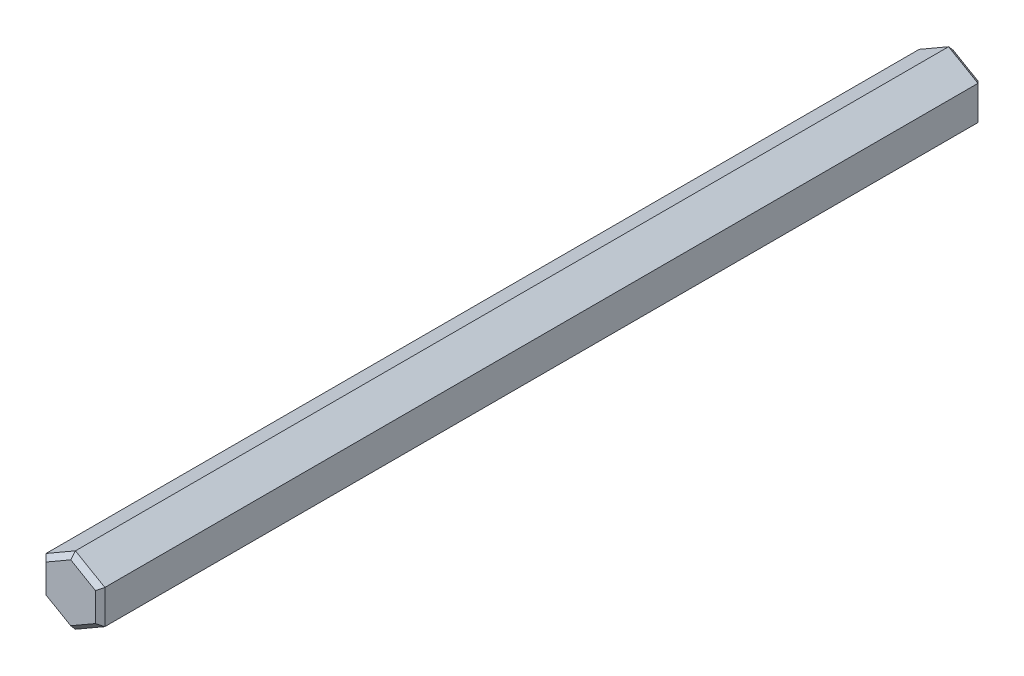
from build123d import *

# Parameters (mm, degrees)
BOSS_EXTRUDE1_DEPTH = 75
CHAMFER1_SIZE       = 0.4


with BuildPart() as part:
    # Sketch1 → Boss-Extrude1 (new body)
    with BuildSketch(Plane.XY.offset(75)):
        Polygon((0, -2.886751346), (2.5, -1.443375673), (2.5, 1.443375673), (0, 2.886751346), (-2.5, 1.443375673), (-2.5, -1.443375673), align=None)
    extrude(amount=-BOSS_EXTRUDE1_DEPTH)

    # Chamfer1
    chamfer1_edges = [part.edges().sort_by_distance(p)[0] for p in [
        (-2.5, 0, 0),
        (-1.25, -2.165063509, 0),
        (-1.25, 2.165063509, 0),
        (1.25, -2.165063509, 0),
        (1.25, 2.165063509, 0),
        (2.5, 0, 0),
        (-1.25, 2.165063509, 75),
        (-2.5, 0, 75),
        (1.25, 2.165063509, 75),
        (-1.25, -2.165063509, 75),
        (2.5, 0, 75),
        (1.25, -2.165063509, 75),
    ]]
    chamfer(chamfer1_edges, length=CHAMFER1_SIZE)


solid = part.part
